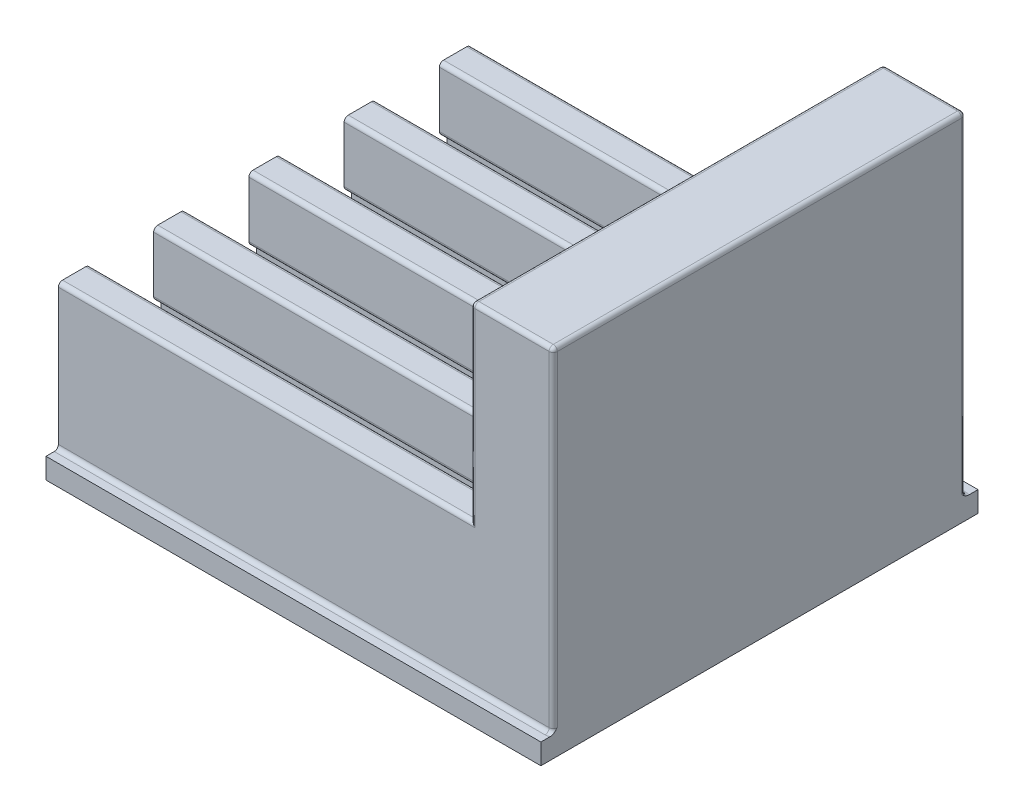
from build123d import *

# Parameters (mm, degrees)
SKETCH1_W           = 120
SKETCH1_H           = 100
BOSS_EXTRUDE1_DEPTH = 81
SKETCH2_W           = 100
SKETCH2_H           = 100
CUT_EXTRUDE1_DEPTH  = 46
SKETCH6_W           = 15.5
SKETCH6_H           = 15.5
CUT_EXTRUDE4_DEPTH  = 100
SKETCH8_W           = 19.1
SKETCH8_H           = 10
CUT_EXTRUDE5_DEPTH  = 100
SKETCH6_3_R         = 5.95
CUT_EXTRUDE6_DEPTH  = 111
FILLET1_R           = 1
CHAMFER1_SIZE       = 1
FILLET2_R           = 1
FILLET3_R           = 1
SKETCH9_W           = 120
SKETCH9_H           = 106
BOSS_EXTRUDE2_DEPTH = 5
FILLET4_R           = 1


with BuildPart() as part:
    # Sketch1 → Boss-Extrude1 (new body)
    with BuildSketch(Plane(origin=(0, 0, 0), x_dir=(1, 0, 0), z_dir=(0, 1, 0))):
        with Locations((-3.53539823, -7.581858407)):
            Rectangle(SKETCH1_W, SKETCH1_H)
    extrude(amount=BOSS_EXTRUDE1_DEPTH)

    # Sketch2 → Cut-Extrude1 (cut)
    with BuildSketch(Plane(origin=(0, 81, 0), x_dir=(1, 0, 0), z_dir=(0, 1, 0))):
        with Locations((-13.53539823, -7.581858407)):
            Rectangle(SKETCH2_W, SKETCH2_H)
    extrude(amount=-CUT_EXTRUDE1_DEPTH, mode=Mode.SUBTRACT)

    # Sketch6 → Cut-Extrude4 (cut)
    with BuildSketch(Plane.ZY.offset(63.53539823)):
        with Locations((-27.068141593, 27.25)):
            Rectangle(SKETCH6_W, SKETCH6_H)
        with Locations((-3.968141593, 27.25)):
            Rectangle(SKETCH6_W, SKETCH6_H)
        with Locations((19.131858407, 27.25)):
            Rectangle(SKETCH6_W, SKETCH6_H)
        with Locations((42.231858407, 27.25)):
            Rectangle(SKETCH6_W, SKETCH6_H)
    extrude(amount=-CUT_EXTRUDE4_DEPTH, mode=Mode.SUBTRACT)

    # Sketch8 → Cut-Extrude5 (cut)
    with BuildSketch(Plane.ZY.offset(63.53539823)):
        with Locations((-27.068141593, 14.5)):
            Rectangle(SKETCH8_W, SKETCH8_H)
        with Locations((-3.968141593, 14.5)):
            Rectangle(SKETCH8_W, SKETCH8_H)
        with Locations((42.231858407, 14.5)):
            Rectangle(SKETCH8_W, SKETCH8_H)
        with Locations((19.131858407, 14.5)):
            Rectangle(SKETCH8_W, SKETCH8_H)
    extrude(amount=-CUT_EXTRUDE5_DEPTH, mode=Mode.SUBTRACT)

    # Sketch6<3> → Cut-Extrude6 (cut)
    with BuildSketch(Plane.ZY.offset(63.53539823)):
        with Locations((-27.068141593, 27.25)):
            Circle(SKETCH6_3_R)
        with Locations((-3.968141593, 27.25)):
            Circle(SKETCH6_3_R)
        with Locations((42.231858407, 27.25)):
            Circle(SKETCH6_3_R)
        with Locations((19.131858407, 27.25)):
            Circle(SKETCH6_3_R)
    extrude(amount=-CUT_EXTRUDE6_DEPTH, mode=Mode.SUBTRACT)

    # Fillet1
    fillet1_edges = [part.edges().sort_by_distance(p)[0] for p in [
        (56.46460177, 81, 7.581858407),
        (46.46460177, 81, 57.581858407),
        (46.46460177, 81, -42.418141593),
        (-13.53539823, 35, -42.418141593),
        (36.46460177, 58, -42.418141593),
        (-13.53539823, 35, 57.581858407),
        (36.46460177, 58, 57.581858407),
        (36.46460177, 81, 7.581858407),
        (56.46460177, 40.5, -42.418141593),
        (56.46460177, 40.5, 57.581858407),
    ]]
    fillet(fillet1_edges, radius=FILLET1_R)

    # Chamfer1
    chamfer1_edges = [part.edges().sort_by_distance(p)[0] for p in [
        (36.46460177, 27.25, -33.018141593),
        (36.46460177, 27.25, -9.918141593),
        (36.46460177, 27.25, 13.181858407),
        (36.46460177, 27.25, 36.281858407),
    ]]
    chamfer(chamfer1_edges, length=CHAMFER1_SIZE)

    # Fillet2
    fillet2_edges = [part.edges().sort_by_distance(p)[0] for p in [
        (47.46460177, 27.25, -33.018141593),
        (47.46460177, 27.25, -9.918141593),
        (47.46460177, 27.25, 13.181858407),
        (47.46460177, 27.25, 36.281858407),
    ]]
    fillet(fillet2_edges, radius=FILLET2_R)

    # Fillet3
    fillet3_edges = [part.edges().sort_by_distance(p)[0] for p in [
        (-13.53539823, 19.5, -19.318141593),
        (-13.53539823, 19.5, -34.818141593),
        (-13.53539823, 35, -34.818141593),
        (-13.53539823, 35, -19.318141593),
        (-13.53539823, 19.5, 3.781858407),
        (-13.53539823, 19.5, -11.718141593),
        (-13.53539823, 35, -11.718141593),
        (-13.53539823, 35, 3.781858407),
        (-13.53539823, 19.5, 49.981858407),
        (-13.53539823, 19.5, 34.481858407),
        (-13.53539823, 35, 34.481858407),
        (-13.53539823, 35, 49.981858407),
        (-13.53539823, 19.5, 26.881858407),
        (-13.53539823, 19.5, 11.381858407),
        (-13.53539823, 35, 11.381858407),
        (-13.53539823, 35, 26.881858407),
    ]]
    fillet(fillet3_edges, radius=FILLET3_R)

    # Sketch9 → Boss-Extrude2 (add)
    with BuildSketch(Plane.XZ):
        with Locations((-3.53539823, 7.581858407)):
            Rectangle(SKETCH9_W, SKETCH9_H)
    extrude(amount=BOSS_EXTRUDE2_DEPTH)

    # Fillet4
    # the kernel refuses this fillet: 1 mm, written as the material it adds along each edge
    with BuildSketch(Plane(origin=(-63.53539823, 0, -42.418141593), x_dir=(0, 0, -1), z_dir=(1, 0, 0)), Plane(origin=(55.46460177, 0, 57.581858407), x_dir=(0, 0, 1), z_dir=(-1, 0, 0))) as fillet4_piece_1:
        with BuildLine():
            CenterArc((FILLET4_R, FILLET4_R), FILLET4_R, 180, 90)
            Line((0, FILLET4_R), (0, 0))
            Line((0, 0), (FILLET4_R, 0))
        make_face()
    extrude(amount=119)
    with BuildSketch(Plane(origin=(55.46460177, 0, -41.418141593), x_dir=(0, 0, -1), z_dir=(-1, 0, 0))) as fillet4_piece_2_section:
        with BuildLine():
            CenterArc((1 + FILLET4_R, -FILLET4_R), FILLET4_R, 90, 90)
            Line((1, -FILLET4_R), (1, 0))
            Line((1, 0), (1 + FILLET4_R, 0))
        make_face()
    fillet4_piece_2 = revolve(axis=Axis((55.46460177, 0, -41.418141593), (0, -1, 0)), revolution_arc=233.296989237, mode=Mode.PRIVATE)
    fillet4_piece_2 = split(fillet4_piece_2, bisect_by=Plane(origin=(56.46460177, 0.167300205, -42.63791684), z_dir=(-1, 0, 0)), keep=Keep.TOP, mode=Mode.PRIVATE)
    add(fillet4_piece_2)
    with BuildSketch(Plane(origin=(55.46460177, 0, 56.581858407), x_dir=(-0.8017442392976468, 0, -0.5976672776328293), z_dir=(-0.5976672776328293, 0, 0.8017442392976468))) as fillet4_piece_3_section:
        with BuildLine():
            CenterArc((1 + FILLET4_R, -FILLET4_R), FILLET4_R, 90, 90)
            Line((1, -FILLET4_R), (1, 0))
            Line((1, 0), (1 + FILLET4_R, 0))
        make_face()
    fillet4_piece_3 = revolve(axis=Axis((55.46460177, 0, 56.581858407), (0, -1, 0)), revolution_arc=233.296989237, mode=Mode.PRIVATE)
    fillet4_piece_3 = split(fillet4_piece_3, bisect_by=Plane(origin=(56.46460177, 0.311628638, 57.331797297), z_dir=(-1, 0, 0)), keep=Keep.TOP, mode=Mode.PRIVATE)
    add(fillet4_piece_3)


solid = part.part
